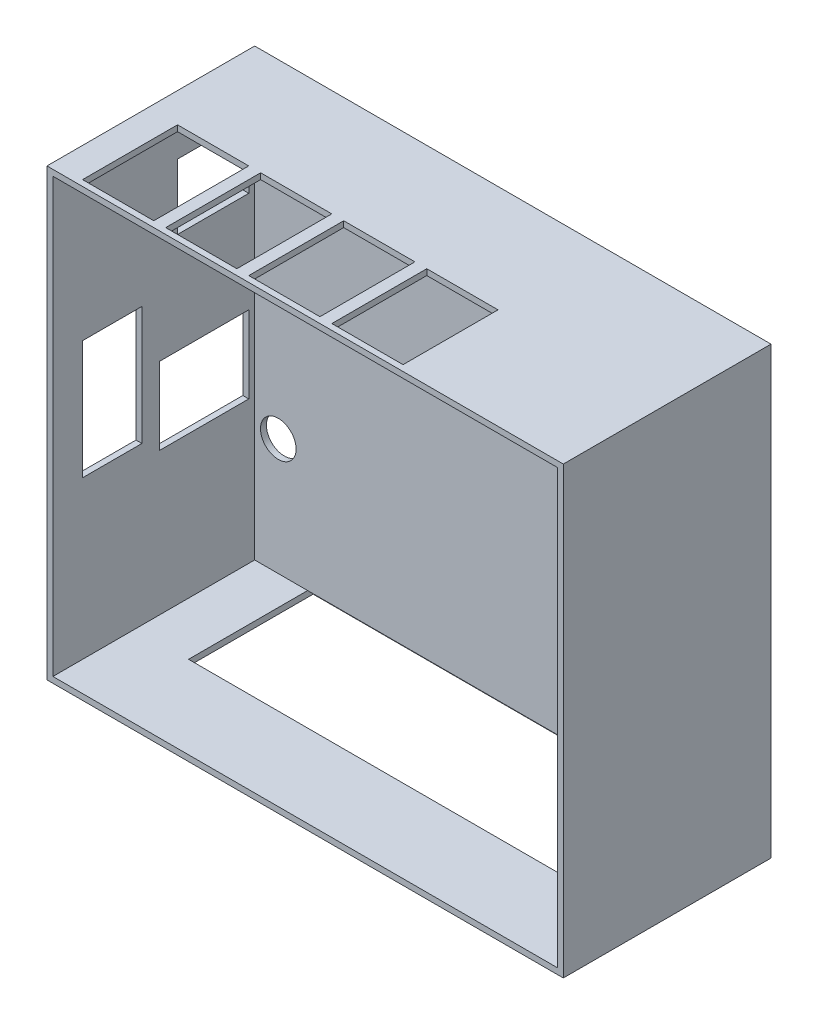
from build123d import *

# Parameters (mm, degrees)
ESQUISSE1_W              = 85
ESQUISSE1_H              = 73
BOSS_EXTRU_2_DEPTH       = 1
ESQUISSE6_W              = 35
ESQUISSE6_H              = 73
BOSS_EXTRU_4_DEPTH       = 1
ESQUISSE8_W              = 35
ESQUISSE8_H              = 73
BOSS_EXTRU_6_DEPTH       = 1
ESQUISSE10_W             = 12
ESQUISSE10_H             = 11
ENL_V_MAT_EXTRU_1_DEPTH  = 1
ESQUISSE11_W             = 15
ESQUISSE11_H             = 13
ENL_V_MAT_EXTRU_2_DEPTH  = 1
ESQUISSE13_W             = 87
ESQUISSE13_H             = 35
BOSS_EXTRU_8_DEPTH       = 1
ESQUISSE14_W             = 12
ESQUISSE14_H             = 16
ENL_V_MAT_EXTRU_3_DEPTH  = 1
ESQUISSE18_W             = 12
ESQUISSE18_H             = 16
ENL_V_MAT_EXTRU_5_DEPTH  = 1
ESQUISSE20_W             = 12
ESQUISSE20_H             = 16
ENL_V_MAT_EXTRU_6_DEPTH  = 1
ESQUISSE21_W             = 12
ESQUISSE21_H             = 16
ENL_V_MAT_EXTRU_7_DEPTH  = 1
ESQUISSE25_W             = 87
ESQUISSE25_H             = 35
BOSS_EXTRU_11_DEPTH      = 1
ESQUISSE26_W             = 77
ESQUISSE26_H             = 21
ENL_V_MAT_EXTRU_13_DEPTH = 1
ESQUISSE23_R             = 3
ENL_V_MAT_EXTRU_14_DEPTH = 10
ESQUISSE22_R             = 3
ENL_V_MAT_EXTRU_15_DEPTH = 10
ESQUISSE24_R             = 3
ENL_V_MAT_EXTRU_18_DEPTH = 10
ESQUISSE27_W             = 10
ESQUISSE27_H             = 20
ENL_V_MAT_EXTRU_19_DEPTH = 1


with BuildPart() as part:
    # Esquisse1 → Boss.-Extru.2 (new body)
    with BuildSketch(Plane.XY):
        with Locations((-89.704998798, 36.5)):
            Rectangle(ESQUISSE1_W, ESQUISSE1_H)
    extrude(amount=BOSS_EXTRU_2_DEPTH)

    # Esquisse6 → Boss.-Extru.4 (add)
    with BuildSketch(Plane(origin=(-47.204998798, 0, 0), x_dir=(0, 0, -1), z_dir=(1, 0, 0))):
        with Locations((-17.5, 36.5)):
            Rectangle(ESQUISSE6_W, ESQUISSE6_H)
    extrude(amount=BOSS_EXTRU_4_DEPTH)

    # Esquisse8 → Boss.-Extru.6 (add)
    with BuildSketch(Plane.ZY.offset(132.204998798)):
        with Locations((17.5, 36.5)):
            Rectangle(ESQUISSE8_W, ESQUISSE8_H)
    extrude(amount=BOSS_EXTRU_6_DEPTH)

    # Esquisse10 → Enlèv. mat.-Extru.1 (cut)
    with BuildSketch(Plane.ZY.offset(133.204998798)):
        with Locations((8, 59.5)):
            Rectangle(ESQUISSE10_W, ESQUISSE10_H)
    extrude(amount=-ENL_V_MAT_EXTRU_1_DEPTH, mode=Mode.SUBTRACT)

    # Esquisse11 → Enlèv. mat.-Extru.2 (cut)
    with BuildSketch(Plane.ZY.offset(133.204998798)):
        with Locations((9.5, 30.5)):
            Rectangle(ESQUISSE11_W, ESQUISSE11_H)
    extrude(amount=-ENL_V_MAT_EXTRU_2_DEPTH, mode=Mode.SUBTRACT)

    # Esquisse13 → Boss.-Extru.8 (add)
    with BuildSketch(Plane(origin=(0, 73, 0), x_dir=(1, 0, 0), z_dir=(0, 1, 0))):
        with Locations((-89.704998798, -17.5)):
            Rectangle(ESQUISSE13_W, ESQUISSE13_H)
    extrude(amount=BOSS_EXTRU_8_DEPTH)

    # Esquisse14 → Enlèv. mat.-Extru.3 (cut)
    with BuildSketch(Plane(origin=(0, 74, 0), x_dir=(1, 0, 0), z_dir=(0, 1, 0))):
        with Locations((-122.207040337, -26)):
            Rectangle(ESQUISSE14_W, ESQUISSE14_H)
    extrude(amount=-ENL_V_MAT_EXTRU_3_DEPTH, mode=Mode.SUBTRACT)

    # Esquisse18 → Enlèv. mat.-Extru.5 (cut)
    with BuildSketch(Plane(origin=(0, 74, 0), x_dir=(1, 0, 0), z_dir=(0, 1, 0))):
        with Locations((-108.207040337, -26)):
            Rectangle(ESQUISSE18_W, ESQUISSE18_H)
    extrude(amount=-ENL_V_MAT_EXTRU_5_DEPTH, mode=Mode.SUBTRACT)

    # Esquisse20 → Enlèv. mat.-Extru.6 (cut)
    with BuildSketch(Plane(origin=(0, 74, 0), x_dir=(1, 0, 0), z_dir=(0, 1, 0))):
        with Locations((-94.207040337, -26)):
            Rectangle(ESQUISSE20_W, ESQUISSE20_H)
    extrude(amount=-ENL_V_MAT_EXTRU_6_DEPTH, mode=Mode.SUBTRACT)

    # Esquisse21 → Enlèv. mat.-Extru.7 (cut)
    with BuildSketch(Plane(origin=(0, 74, 0), x_dir=(1, 0, 0), z_dir=(0, 1, 0))):
        with Locations((-80.207040337, -26)):
            Rectangle(ESQUISSE21_W, ESQUISSE21_H)
    extrude(amount=-ENL_V_MAT_EXTRU_7_DEPTH, mode=Mode.SUBTRACT)

    # Esquisse25 → Boss.-Extru.11 (add)
    with BuildSketch(Plane.XZ):
        with Locations((-89.704998798, 17.5)):
            Rectangle(ESQUISSE25_W, ESQUISSE25_H)
    extrude(amount=BOSS_EXTRU_11_DEPTH)

    # Esquisse26 → Enlèv. mat.-Extru.13 (cut)
    with BuildSketch(Plane.XZ.offset(1)):
        with Locations((-84.785991567, 10.567106243)):
            Rectangle(ESQUISSE26_W, ESQUISSE26_H)
    extrude(amount=-ENL_V_MAT_EXTRU_13_DEPTH, mode=Mode.SUBTRACT)

    # Esquisse23 → Enlèv. mat.-Extru.14 (cut)
    with BuildSketch(Plane.XY.offset(1)):
        with Locations((-128.228777758, 19.66052326)):
            Circle(ESQUISSE23_R)
    extrude(amount=-ENL_V_MAT_EXTRU_14_DEPTH, mode=Mode.SUBTRACT)

    # Esquisse22 → Enlèv. mat.-Extru.15 (cut)
    with BuildSketch(Plane.XY.offset(1)):
        with Locations((-128.334603856, 69.17039525)):
            Circle(ESQUISSE22_R)
    extrude(amount=-ENL_V_MAT_EXTRU_15_DEPTH, mode=Mode.SUBTRACT)

    # Esquisse24 → Enlèv. mat.-Extru.18 (cut)
    with BuildSketch(Plane.XY.offset(1)):
        with Locations((-70.21638406, 69.222983718)):
            Circle(ESQUISSE24_R)
    extrude(amount=-ENL_V_MAT_EXTRU_18_DEPTH, mode=Mode.SUBTRACT)

    # Esquisse27 → Enlèv. mat.-Extru.19 (cut)
    with BuildSketch(Plane.ZY.offset(133.204998798)):
        with Locations((25, 36.5)):
            Rectangle(ESQUISSE27_W, ESQUISSE27_H)
    extrude(amount=-ENL_V_MAT_EXTRU_19_DEPTH, mode=Mode.SUBTRACT)


solid = part.part
